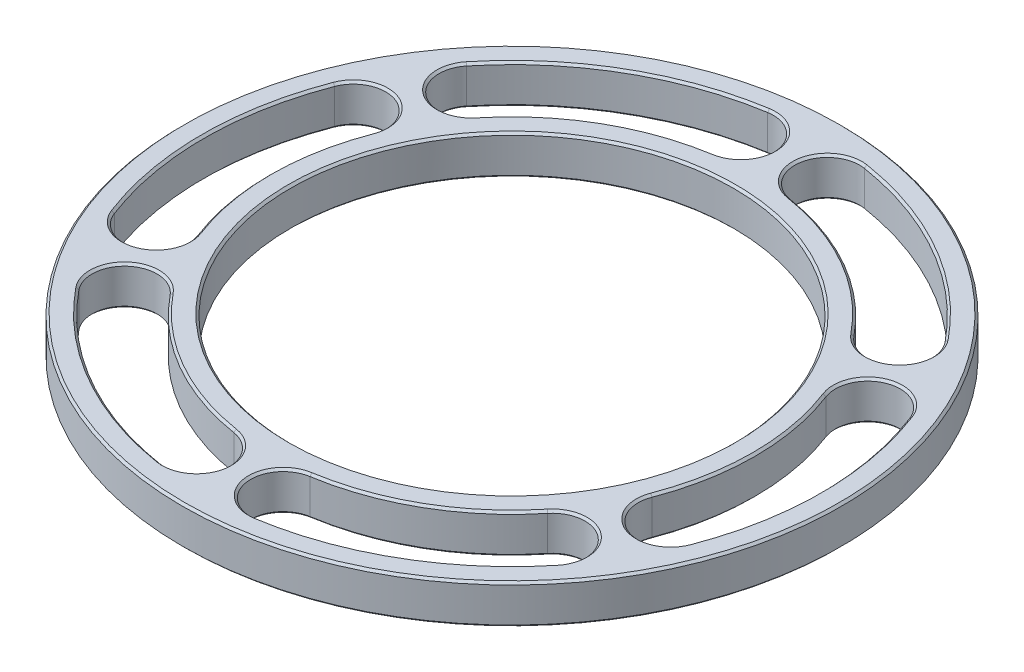
from build123d import *

# Parameters (mm, degrees)
SKETCH1_W                    = 24.97495
SKETCH1_H                    = 9
CUT_EXTRUDE1_DEPTH           = 10
CHAMFER3_SIZE                = 0.5
CHAMFER4_SIZE                = 0.5
CIRPATTERN1_COUNT            = 6
CHAMFER4_OF_CIRPATTERN1_SIZE = 0.5


with BuildPart() as part:
    # Sketch1 → Revolve1 (revolve)
    with BuildSketch(Plane.XY):
        with Locations((63.612525, 4.5)):
            Rectangle(SKETCH1_W, SKETCH1_H)
    revolve(axis=Axis((0, 0, 0), (0, 1, 0)))

    # Sketch2 → Cut-Extrude1 (cut)
    with BuildSketch(Plane(origin=(0, 9, 0), x_dir=(1, 0, 0), z_dir=(0, 1, 0))):
        with BuildLine():
            ThreePointArc((-52.408855323, 20.083155161), (-56.721330267, 29.754097391), (-66.392272497, 25.441622447))
            ThreePointArc((-66.392272497, 25.441622447), (-71.1, 0), (-66.392272497, -25.441622447))
            ThreePointArc((-66.392272497, -25.441622447), (-56.721330267, -29.754097391), (-52.408855323, -20.083155161))
            ThreePointArc((-52.408855323, -20.083155161), (-56.12505, 0), (-52.408855323, 20.083155161))
        make_face()
    cut_extrude1 = extrude(amount=-CUT_EXTRUDE1_DEPTH, mode=Mode.SUBTRACT)

    # Chamfer3
    chamfer3_edges = [part.edges().sort_by_distance(p)[0] for p in [
        (-76.1, 0, 0),
        (-76.1, 9, 0),
        (-51.12505, 0, 0),
        (-51.12505, 9, 0),
    ]]
    chamfer(chamfer3_edges, length=CHAMFER3_SIZE)

    # Chamfer4
    chamfer4_edges = [part.edges().sort_by_distance(p)[0] for p in [
        (-56.721330267, 9, -29.754097391),
        (-56.721330267, 0, 29.754097391),
        (-71.1, 0, 0),
        (-56.12505, 0, 0),
        (-56.721330267, 0, -29.754097391),
        (-71.1, 9, 0),
        (-56.12505, 9, 0),
        (-56.721330267, 9, 29.754097391),
    ]]
    chamfer(chamfer4_edges, length=CHAMFER4_SIZE)

    # CirPattern1: Cut-Extrude1 ×6 about axis
    cirpattern1_axis = Axis((0, 9, 0), (0, -1, 0))
    for i in range(1, CIRPATTERN1_COUNT):
        add(cut_extrude1.rotate(cirpattern1_axis, i * 360 / CIRPATTERN1_COUNT), mode=Mode.SUBTRACT)

    # Chamfer4 of CirPattern1
    chamfer4_of_cirpattern1_edges = [part.edges().sort_by_distance(p)[0] for p in [
        (-2.592860926, 9, -63.999161643),
        (-54.12846934, 0, -34.245064252),
        (-35.55, 0, -61.574406209),
        (-28.062525, 0, -48.605719089),
        (-2.592860926, 0, -63.999161643),
        (-35.55, 9, -61.574406209),
        (-28.062525, 9, -48.605719089),
        (-54.12846934, 9, -34.245064252),
        (54.12846934, 9, -34.245064252),
        (2.592860926, 0, -63.999161643),
        (35.55, 0, -61.574406209),
        (28.062525, 0, -48.605719089),
        (54.12846934, 0, -34.245064252),
        (35.55, 9, -61.574406209),
        (28.062525, 9, -48.605719089),
        (2.592860926, 9, -63.999161643),
        (56.721330267, 9, 29.754097391),
        (56.721330267, 0, -29.754097391),
        (71.1, 0, 0),
        (56.12505, 0, 0),
        (56.721330267, 0, 29.754097391),
        (71.1, 9, 0),
        (56.12505, 9, 0),
        (56.721330267, 9, -29.754097391),
        (2.592860926, 9, 63.999161643),
        (54.12846934, 0, 34.245064252),
        (35.55, 0, 61.574406209),
        (28.062525, 0, 48.605719089),
        (2.592860926, 0, 63.999161643),
        (35.55, 9, 61.574406209),
        (28.062525, 9, 48.605719089),
        (54.12846934, 9, 34.245064252),
        (-54.12846934, 9, 34.245064252),
        (-2.592860926, 0, 63.999161643),
        (-35.55, 0, 61.574406209),
        (-28.062525, 0, 48.605719089),
        (-54.12846934, 0, 34.245064252),
        (-35.55, 9, 61.574406209),
        (-28.062525, 9, 48.605719089),
        (-2.592860926, 9, 63.999161643),
    ]]
    chamfer(chamfer4_of_cirpattern1_edges, length=CHAMFER4_OF_CIRPATTERN1_SIZE)


solid = part.part
